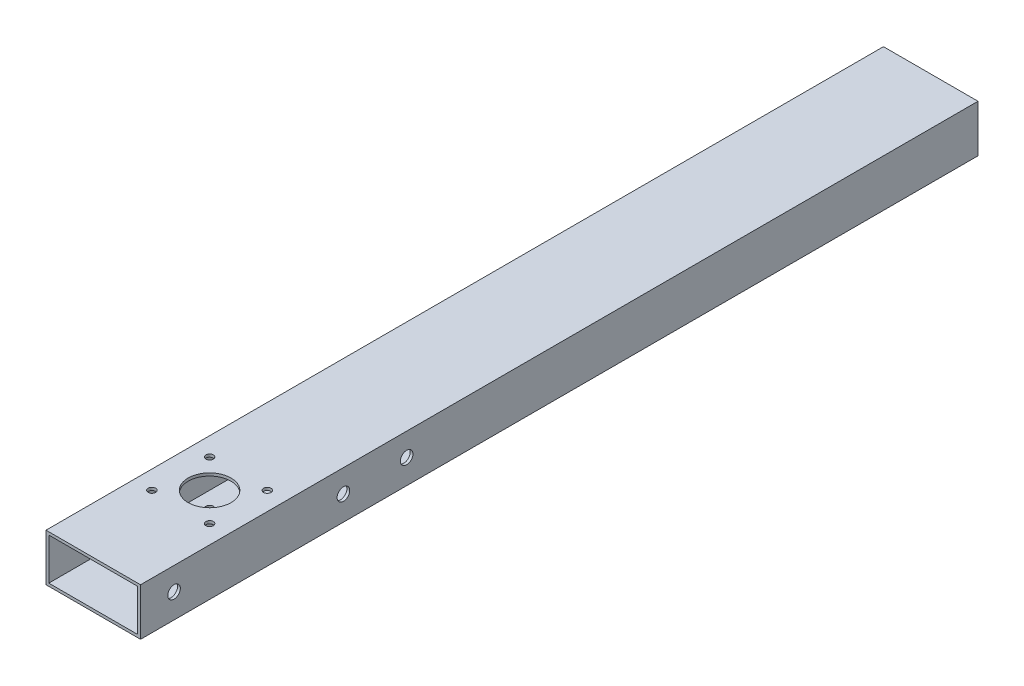
from build123d import *

# Parameters (mm, degrees)
CROQUIS1_W                    = 50.8
CROQUIS1_H                    = 25.4
CROQUIS1_W_2                  = 47.8
CROQUIS1_H_2                  = 22.4
SALIENTE_EXTRUIR1_DEPTH       = 450
CROQUIS2_R                    = 11.5
CROQUIS2_R_2                  = 2
CORTAR_EXTRUIR1_DEPTH         = 26
TALADRO_DE_MARGEN_PARA_1_41_D = 6.7564


with BuildPart() as part:
    # Croquis1 → Saliente-Extruir1 (new body)
    with BuildSketch(Plane.XY):
        Rectangle(CROQUIS1_W, CROQUIS1_H)
        Rectangle(CROQUIS1_W_2, CROQUIS1_H_2, mode=Mode.SUBTRACT)
    extrude(amount=SALIENTE_EXTRUIR1_DEPTH)

    # Croquis2 → Cortar-Extruir1 (cut)
    with BuildSketch(Plane(origin=(0, -12.7, 0), x_dir=(-1, 0, 0), z_dir=(0, -1, 0))):
        with Locations((0, -387.5)):
            Circle(CROQUIS2_R)
        with Locations((15.5, -403)):
            Circle(CROQUIS2_R_2)
        with Locations((-15.5, -403)):
            Circle(CROQUIS2_R_2)
        with Locations((-15.5, -372)):
            Circle(CROQUIS2_R_2)
        with Locations((15.5, -372)):
            Circle(CROQUIS2_R_2)
    extrude(amount=-CORTAR_EXTRUIR1_DEPTH, mode=Mode.SUBTRACT)

    # Taladro de margen para 1/41 (through all)
    with Locations(Plane(origin=(-25.4, 197.888619806, 162.989101594), x_dir=(0, -1, 0), z_dir=(-1, 0, 0))):
        with Locations((197.488619806, 269.010898406), (197.488619806, 178.010898406), (197.488619806, 144.010898406), (572.888619806, 144.010898406), (572.888619806, 178.010898406), (572.888619806, 269.010898406)):
            Hole(TALADRO_DE_MARGEN_PARA_1_41_D / 2)


solid = part.part
